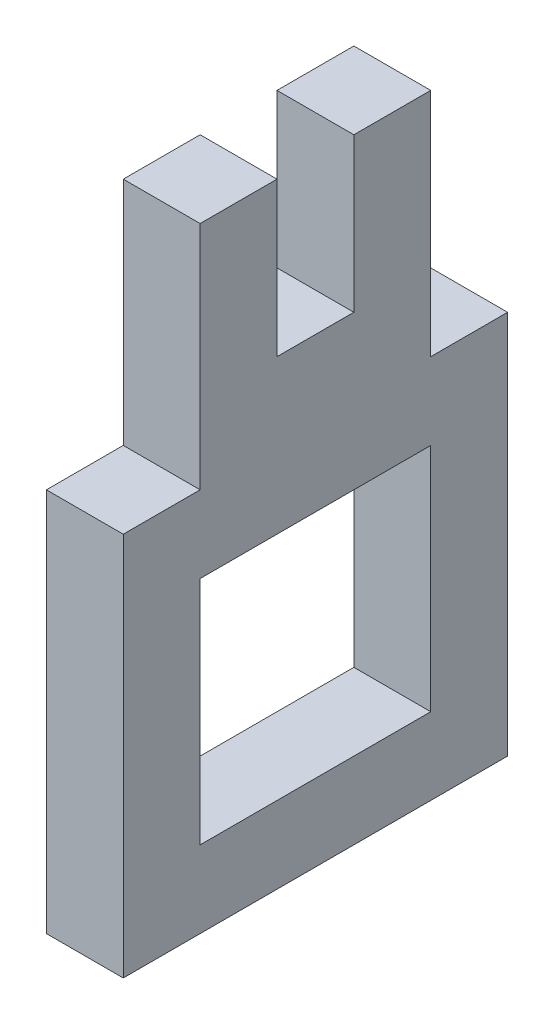
from build123d import *

# Parameters (mm, degrees)
SKETCH2_W           = 19.05
SKETCH2_H           = 19.05
BOSS_EXTRUDE1_DEPTH = 6.35


with BuildPart() as part:
    # Sketch2 → Boss-Extrude1 (new body)
    with BuildSketch(Plane(origin=(0, 0, 0), x_dir=(0, 0, -1), z_dir=(1, 0, 0))):
        Polygon((12.7, 50.8), (12.7, 38.1), (19.05, 38.1), (19.05, 50.8), (25.4, 50.8), (25.4, 31.75), (31.75, 31.75), (31.75, 0), (0, 0), (0, 31.75), (6.35, 31.75), (6.35, 50.8), align=None)
        with Locations((15.875, 15.875)):
            Rectangle(SKETCH2_W, SKETCH2_H, mode=Mode.SUBTRACT)
    extrude(amount=BOSS_EXTRUDE1_DEPTH)


solid = part.part
